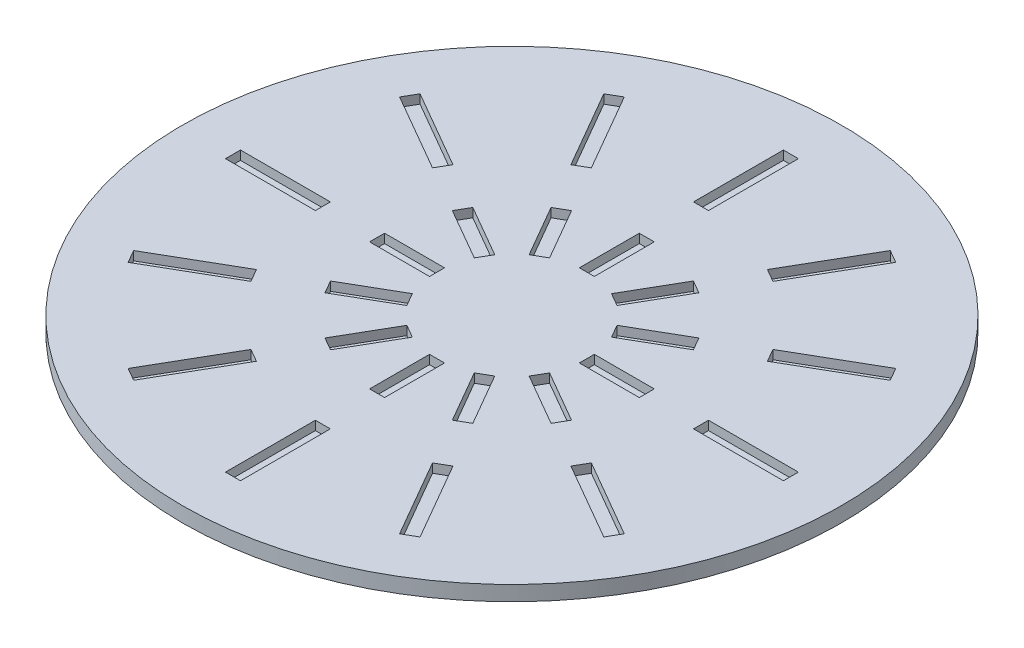
from build123d import *

# Parameters (mm, degrees)
SKETCH1_R           = 109.979208013
SKETCH1_R_2         = 55.789490447
BOSS_EXTRUDE1_DEPTH = 5
SKETCH1_3_R         = 55.789490447
BOSS_EXTRUDE2_DEPTH = 10
SKETCH1_4_W         = 5
SKETCH1_4_H         = 20
SKETCH1_4_H_2       = 30
CUT_EXTRUDE1_DEPTH  = 3
CIRPATTERN1_COUNT   = 12
SKETCH4_R           = 2.261632511
BOSS_EXTRUDE3_DEPTH = 8
CHAMFER1_SIZE2      = 2.331538291
CHAMFER1_SIZE       = 5


with BuildPart() as part:
    # Sketch1 → Boss-Extrude1 (new body)
    with BuildSketch(Plane(origin=(0, 0, 0), x_dir=(1, 0, 0), z_dir=(0, 1, 0))):
        with Locations(Location((0, 0, 0), (0, 0, 270))):
            Circle(SKETCH1_R)
        with Locations(Location((0, 0, 0), (0, 0, 270))):
            Circle(SKETCH1_R_2, mode=Mode.SUBTRACT)
    extrude(amount=-BOSS_EXTRUDE1_DEPTH)

    # Sketch1<3> → Boss-Extrude2 (add)
    with BuildSketch(Plane(origin=(0, 0, 0), x_dir=(1, 0, 0), z_dir=(0, 1, 0))):
        with Locations(Location((0, 0, 0), (0, 0, 270))):
            Circle(SKETCH1_3_R)
    extrude(amount=-BOSS_EXTRUDE2_DEPTH)

    # Sketch1<4> → Cut-Extrude1 (cut)
    with BuildSketch(Plane(origin=(0, 0, 0), x_dir=(1, 0, 0), z_dir=(0, 1, 0))):
        with Locations((0, 35)):
            Rectangle(SKETCH1_4_W, SKETCH1_4_H)
        with Locations((0, 78.089349727)):
            Rectangle(SKETCH1_4_W, SKETCH1_4_H_2)
    cut_extrude1 = extrude(amount=-CUT_EXTRUDE1_DEPTH, mode=Mode.SUBTRACT)

    # CirPattern1: Cut-Extrude1 ×12 about axis
    cirpattern1_axis = Axis((0, 0, 0), (0, 1, 0))
    for i in range(1, CIRPATTERN1_COUNT):
        add(cut_extrude1.rotate(cirpattern1_axis, i * 360 / CIRPATTERN1_COUNT), mode=Mode.SUBTRACT)

    # Sketch4 → Boss-Extrude3 (add)
    with BuildSketch(Plane.XY.offset(10)):
        with BuildLine():
            Line((-30.05733698, -10), (30.05733698, -10))
            Line((30.05733698, -10), (30.05733698, -10.774181914))
            ThreePointArc((30.05733698, -10.774181914), (0, -46.529878203), (-30.05733698, -10.774181914))
            Line((-30.05733698, -10.774181914), (-30.05733698, -10))
        make_face()
        with Locations((0, -26.625171413)):
            Circle(SKETCH4_R, mode=Mode.SUBTRACT)
    boss_extrude3 = extrude(amount=BOSS_EXTRUDE3_DEPTH)

    # Mirror1: Boss-Extrude3 across plane
    add(boss_extrude3.mirror(Plane.XY))

    # Chamfer1
    chamfer1_edges = [part.edges().sort_by_distance(p)[0] for p in [
        (0, -10, -55.789490447),
    ]]
    chamfer1_side = [part.faces().sort_by_distance(p)[0] for p in [
        (0, -9.953369234, -55.789490447),
    ]]
    chamfer(chamfer1_edges, length=CHAMFER1_SIZE - 0.0001, length2=CHAMFER1_SIZE2 - 0.0001, reference=chamfer1_side[0])  # a hair under: the kernel refuses the full size


solid = part.part
